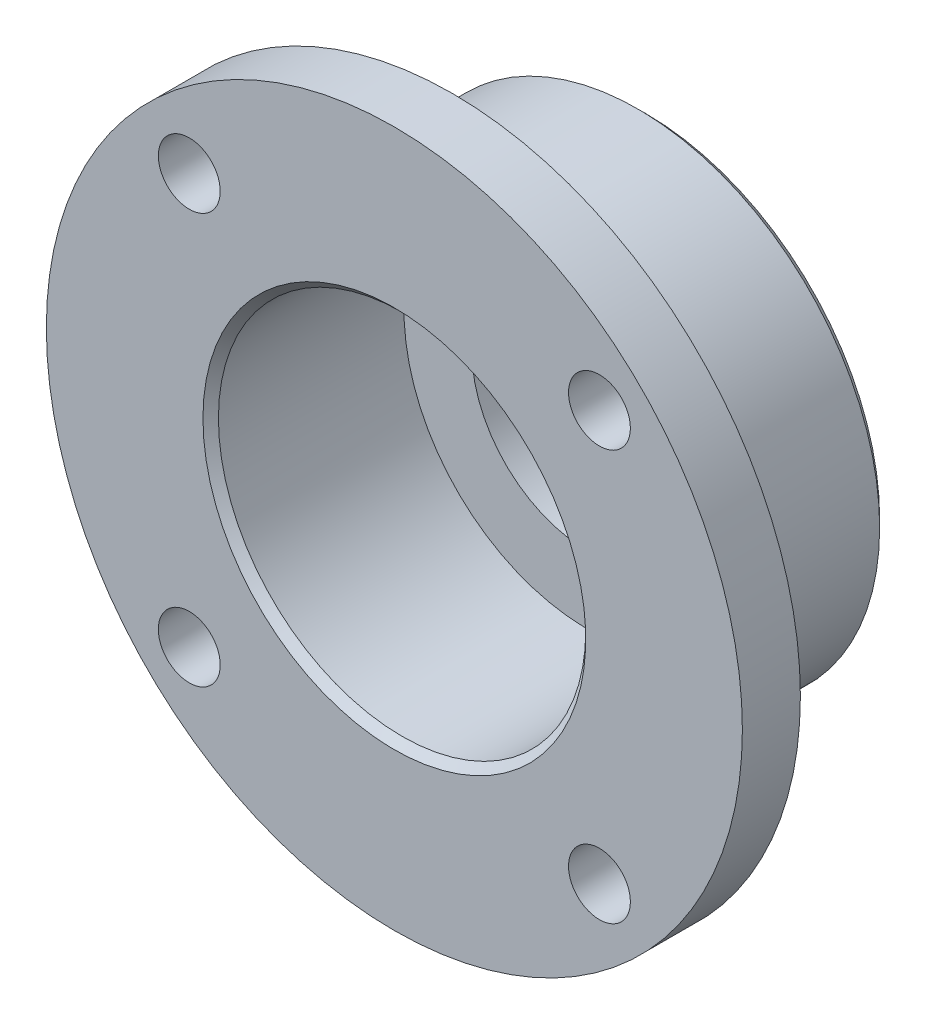
from build123d import *

# Parameters (mm, degrees)
CUT_EXTRUDE_1_REACH      = 30.583
SKETCH_2_R               = 1.6
PATTERN_CIRCULAR_1_COUNT = 4
CHAMFER_1_SIZE           = 0.4


with BuildPart() as part:
    # Эскиз1 → Повернуть1 (revolve)
    with BuildSketch(Plane(origin=(0, 0, 0), x_dir=(1, 0, 0), z_dir=(0, 1, 0))):
        Polygon((-18, 0), (-18, 3), (-12.5, 3), (-12.5, 13), (-6, 13), (-6, 10), (-9.5, 10), (-9.5, 0), align=None)
    revolve(axis=Axis((0, 0, 0), (0, 0, -1)))

    # Эскиз2 → Вырез-Вытянуть1 (cut, up to next)
    with BuildSketch(Plane.XY, mode=Mode.PRIVATE) as cut_extrude_1_sk1:
        with Locations((10.606601718, 10.606601718)):
            Circle(SKETCH_2_R)
    cut_extrude_1_tool1 = extrude(cut_extrude_1_sk1.sketch, amount=-CUT_EXTRUDE_1_REACH, mode=Mode.PRIVATE) & part.part
    cut_extrude_1 = cut_extrude_1_tool1.solids().sort_by_distance((10.606602, 10.606602, 0))[0]
    add(cut_extrude_1, mode=Mode.SUBTRACT)

    # Круговой массив1: Вырез-Вытянуть1 ×4 about axis
    pattern_circular_1_axis = Axis((0, 0, 0), (0, 0, 1))
    for i in range(1, PATTERN_CIRCULAR_1_COUNT):
        add(cut_extrude_1.rotate(pattern_circular_1_axis, i * 360 / PATTERN_CIRCULAR_1_COUNT), mode=Mode.SUBTRACT)

    # Фаска1
    chamfer_1_edges = [part.edges().sort_by_distance(p)[0] for p in [
        (12.5, 0, -13),
        (9.5, 0, 0),
    ]]
    chamfer(chamfer_1_edges, length=CHAMFER_1_SIZE)


solid = part.part
